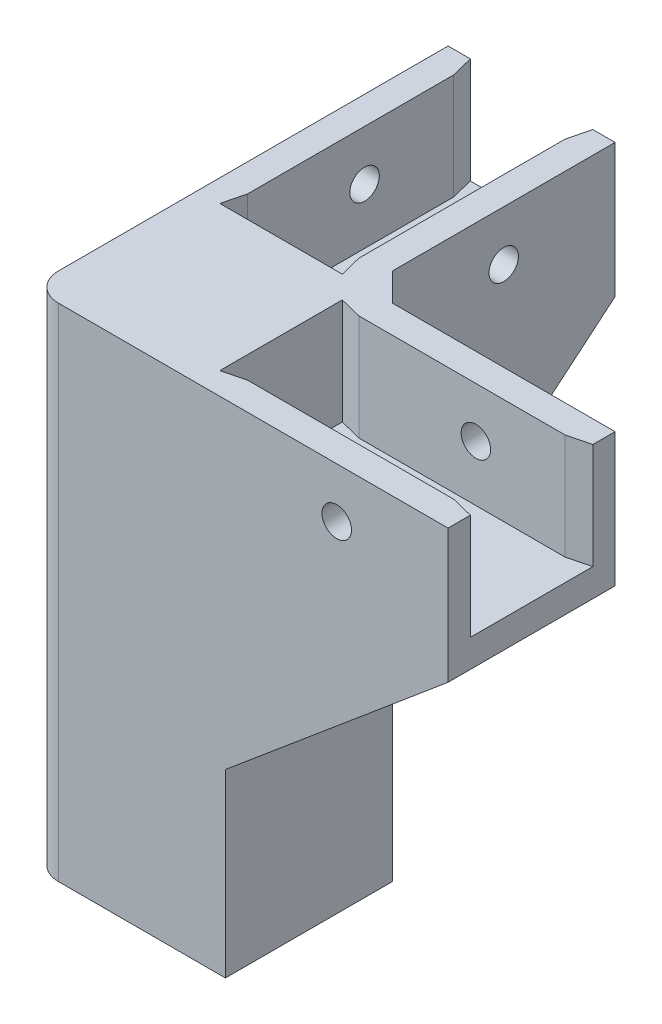
from build123d import *

# Parameters (mm, degrees)
SKETCH1_W                = 75
SKETCH1_H                = 75
BOSS_EXTRUDE1_DEPTH      = 90
SKETCH2_W                = 45
SKETCH2_H                = 20
SKETCH2_W_2              = 20
SKETCH2_H_2              = 45
CUT_EXTRUDE2_DEPTH       = 19
SKETCH3_W                = 45
SKETCH3_H                = 45
CUT_EXTRUDE3_DEPTH       = 140.104277432
CUT_EXTRUDE4_DEPTH       = 140.104277432
CUT_EXTRUDE5_DEPTH       = 126.49900398
FILLET1_R                = 5
CUT_EXTRUDE10_DEPTH      = 126.49900398
CUT_EXTRUDE10_DEPTH_BACK = 126.49900398
SKETCH7_R                = 2.65
CUT_EXTRUDE11_DEPTH      = 126.49900398
CUT_EXTRUDE11_DEPTH_BACK = 126.49900398
SKETCH8_R                = 2.65
SKETCH9_R                = 2.65
CUT_EXTRUDE12_DEPTH      = 128.636201761
SKETCH10_R               = 5.5
CUT_EXTRUDE13_DEPTH      = 125.923976882
CHAMFER3_SIZE            = 5
CUT_EXTRUDE14_DEPTH      = 19


with BuildPart() as part:
    # Sketch1 → Boss-Extrude1 (new body)
    with BuildSketch(Plane(origin=(0, 0, 0), x_dir=(1, 0, 0), z_dir=(0, 1, 0))):
        with Locations((37.5, 37.5)):
            Rectangle(SKETCH1_W, SKETCH1_H)
    extrude(amount=BOSS_EXTRUDE1_DEPTH)

    # Sketch2 → Cut-Extrude2 (cut)
    with BuildSketch(Plane(origin=(0, 90, 0), x_dir=(1, 0, 0), z_dir=(0, 1, 0))):
        with Locations((52.5, 15)):
            Rectangle(SKETCH2_W, SKETCH2_H)
        with Locations((15, 52.5)):
            Rectangle(SKETCH2_W_2, SKETCH2_H_2)
    extrude(amount=-CUT_EXTRUDE2_DEPTH, mode=Mode.SUBTRACT)

    # Sketch3 → Cut-Extrude3 (cut, through all)
    with BuildSketch(Plane(origin=(0, 90, 0), x_dir=(1, 0, 0), z_dir=(0, 1, 0))):
        with Locations((52.5, 52.5)):
            Rectangle(SKETCH3_W, SKETCH3_H)
    extrude(amount=-CUT_EXTRUDE3_DEPTH, mode=Mode.SUBTRACT)

    # Sketch4 → Cut-Extrude4 (cut, through all)
    with BuildSketch(Plane.XY):
        Polygon((35, 32.436014753), (35, 0), (75, 0), (75, 66), align=None)
    extrude(amount=-CUT_EXTRUDE4_DEPTH, mode=Mode.SUBTRACT)

    # Sketch5 → Cut-Extrude5 (cut, through all)
    with BuildSketch(Plane(origin=(30, 0, 0), x_dir=(0, 0, -1), z_dir=(1, 0, 0))):
        Polygon((35, 0), (35, 32.436014753), (75, 66), (75, 0), align=None)
    extrude(amount=-CUT_EXTRUDE5_DEPTH, mode=Mode.SUBTRACT)

    # Fillet1
    fillet1_edges = [part.edges().sort_by_distance(p)[0] for p in [
        (0, 45, 0),
    ]]
    fillet(fillet1_edges, radius=FILLET1_R)

    # Sketch7 → Cut-Extrude10 (cut, two sides: drawn at the far end of the back side and taken through both)
    with BuildSketch(Plane(origin=(0, 0, -30), x_dir=(-1, 0, 0), z_dir=(0, 0, -1)).offset(-CUT_EXTRUDE10_DEPTH_BACK)):
        with Locations((-55, 81)):
            Circle(SKETCH7_R)
    extrude(amount=CUT_EXTRUDE10_DEPTH + CUT_EXTRUDE10_DEPTH_BACK, mode=Mode.SUBTRACT)

    # Sketch8 → Cut-Extrude11 (cut, two sides: drawn at the far end of the back side and taken through both)
    with BuildSketch(Plane(origin=(30, 0, 0), x_dir=(0, 0, -1), z_dir=(1, 0, 0)).offset(-CUT_EXTRUDE11_DEPTH_BACK)):
        with Locations((55, 81)):
            Circle(SKETCH8_R)
    extrude(amount=CUT_EXTRUDE11_DEPTH + CUT_EXTRUDE11_DEPTH_BACK, mode=Mode.SUBTRACT)

    # Sketch9 → Cut-Extrude12 (cut, through all)
    with BuildSketch(Plane(origin=(0, 71, 0), x_dir=(1, 0, 0), z_dir=(0, 1, 0))):
        with Locations(Location((15, 55, 0), (0, 0, 270))):
            Circle(SKETCH9_R)
        with Locations(Location((55, 15, 0), (0, 0, 270))):
            Circle(SKETCH9_R)
    extrude(amount=-CUT_EXTRUDE12_DEPTH, mode=Mode.SUBTRACT)

    # Sketch10 → Cut-Extrude13 (cut, through all)
    with BuildSketch(Plane(origin=(0, 66, 0), x_dir=(1, 0, 0), z_dir=(0, 1, 0))):
        with Locations(Location((55, 15, 0), (0, 0, 270))):
            Circle(SKETCH10_R)
        with Locations(Location((15, 55, 0), (0, 0, 270))):
            Circle(SKETCH10_R)
    extrude(amount=-CUT_EXTRUDE13_DEPTH, mode=Mode.SUBTRACT)

    # Chamfer3
    chamfer3_edges = [part.edges().sort_by_distance(p)[0] for p in [
        (30, 45, -30),
    ]]
    chamfer(chamfer3_edges, length=CHAMFER3_SIZE - 0.0001)  # a hair under: the kernel refuses the full size

    # Sketch11 → Cut-Extrude14 (cut)
    with BuildSketch(Plane(origin=(0, 90, 0), x_dir=(1, 0, 0), z_dir=(0, 1, 0))):
        Polygon((5, 30), (4, 30), (5, 34), align=None)
        Polygon((25, 30), (26, 30), (25, 34), align=None)
        Polygon((30, 25), (34, 25), (30, 26), align=None)
        Polygon((30, 5), (30, 4), (34, 5), align=None)
        Polygon((25, 75), (26, 75), (25, 71), align=None)
        Polygon((5, 71), (5, 75), (4, 75), align=None)
        Polygon((75, 5), (71, 5), (75, 4), align=None)
        Polygon((71, 25), (75, 25), (75, 26), align=None)
    extrude(amount=-CUT_EXTRUDE14_DEPTH, mode=Mode.SUBTRACT)


solid = part.part
